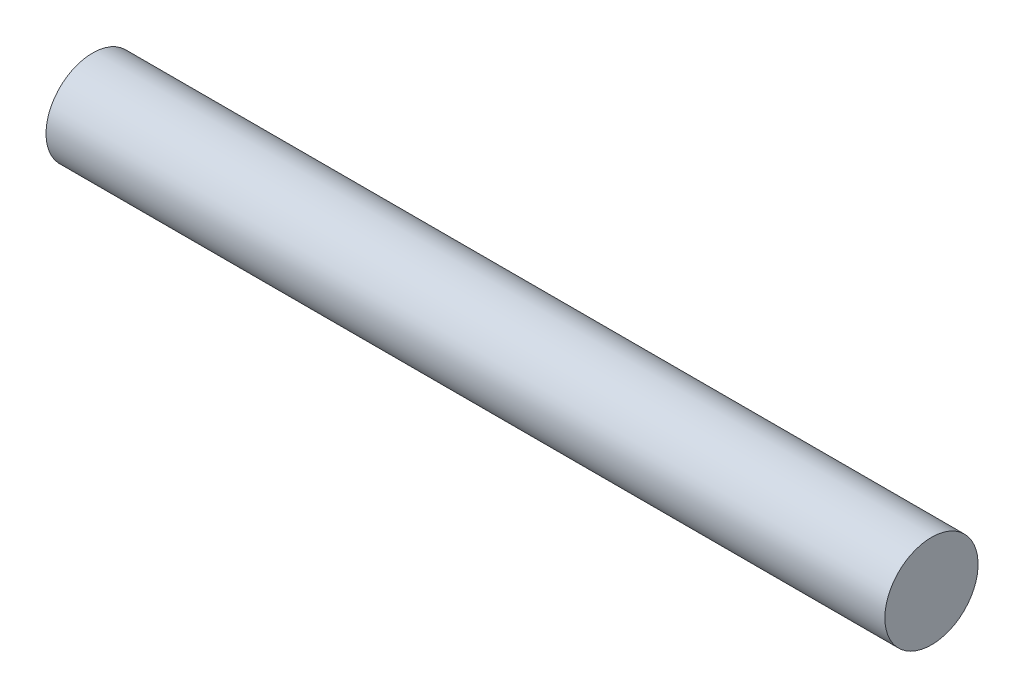
from build123d import *

# Parameters (mm, degrees)
SKETCH1_R           = 10
BOSS_EXTRUDE1_DEPTH = 180


with BuildPart() as part:
    # Sketch1 → Boss-Extrude1 (new body)
    with BuildSketch(Plane(origin=(0, 0, 0), x_dir=(0, 0, -1), z_dir=(1, 0, 0))):
        Circle(SKETCH1_R)
    extrude(amount=BOSS_EXTRUDE1_DEPTH)


solid = part.part
